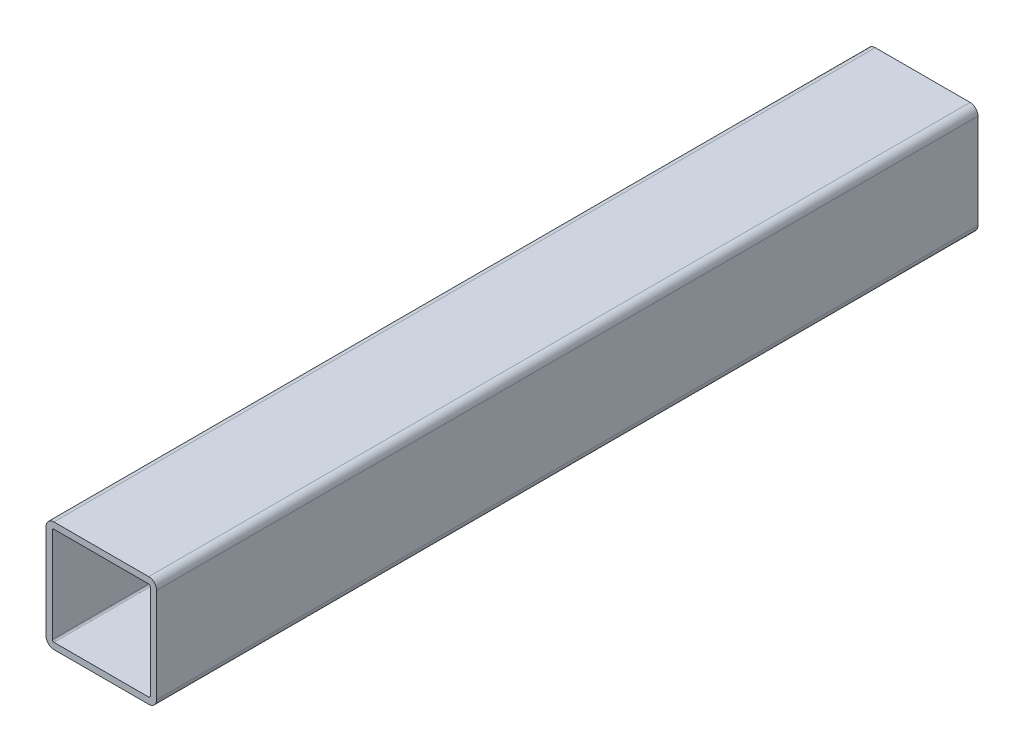
from build123d import *

# Parameters (mm, degrees)
BOSS_EXTRUDE1_DEPTH = 520


with BuildPart() as part:
    # Sketch1 → Boss-Extrude1 (new body)
    with BuildSketch(Plane.XY):
        with BuildLine():
            Line((5, 0), (65, 0))
            ThreePointArc((65, 0), (68.535533906, 1.464466094), (70, 5))
            Line((70, 5), (70, 65))
            ThreePointArc((70, 65), (68.535533906, 68.535533906), (65, 70))
            Line((65, 70), (5, 70))
            ThreePointArc((5, 70), (1.464466094, 68.535533906), (0, 65))
            Line((0, 65), (0, 5))
            ThreePointArc((0, 5), (1.464466094, 1.464466094), (5, 0))
        make_face()
        with BuildLine():
            Line((4, 5), (4, 65))
            ThreePointArc((4, 65), (4.292893219, 65.707106781), (5, 66))
            Line((5, 66), (65, 66))
            ThreePointArc((65, 66), (65.707106781, 65.707106781), (66, 65))
            Line((66, 65), (66, 5))
            ThreePointArc((66, 5), (65.707106781, 4.292893219), (65, 4))
            Line((65, 4), (5, 4))
            ThreePointArc((5, 4), (4.292893219, 4.292893219), (4, 5))
        make_face(mode=Mode.SUBTRACT)
    extrude(amount=BOSS_EXTRUDE1_DEPTH)


solid = part.part
